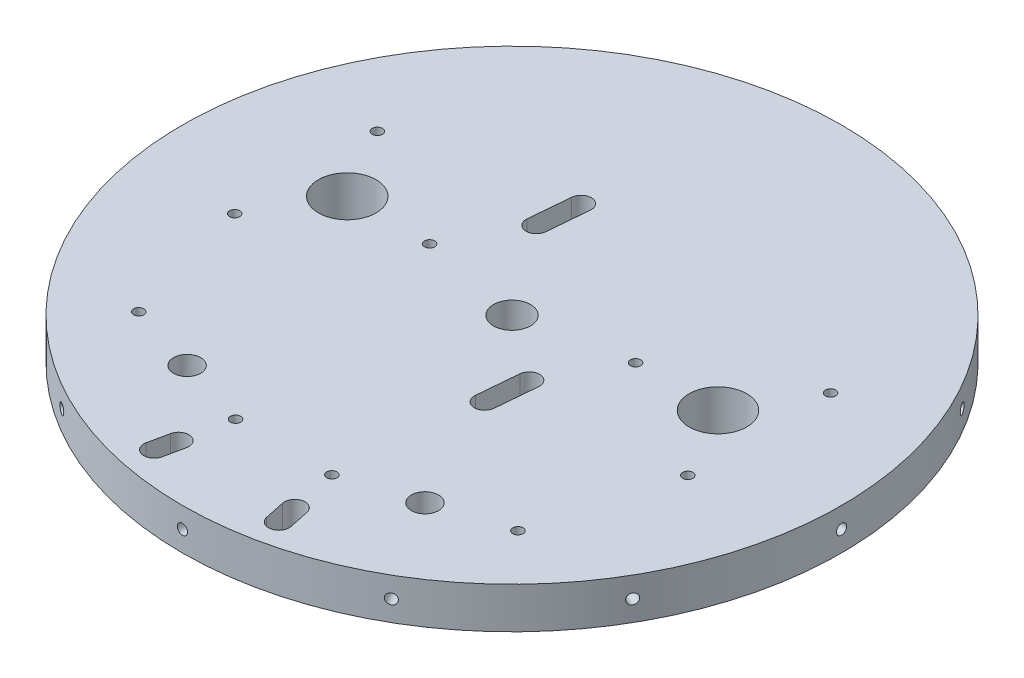
from build123d import *

# Parameters (mm, degrees)
SKETCH1_R           = 80
BOSS_EXTRUDE1_DEPTH = 10
SKETCH3_R           = 4.5
CUT_EXTRUDE1_DEPTH  = 12
SKETCH4_R           = 7
CUT_EXTRUDE2_DEPTH  = 12
SKETCH5_R           = 1.25
CUT_EXTRUDE3_DEPTH  = 15
CIRPATTERN1_COUNT   = 12
CUT_EXTRUDE4_REACH  = 115.578
SKETCH6_R           = 1.25
SKETCH9_R           = 12.5
CUT_EXTRUDE5_DEPTH  = 3
CUT_EXTRUDE6_REACH  = 115.578
SKETCH10_R          = 3.3
CUT_EXTRUDE7_REACH  = 115.578
SKETCH11_R          = 1.25
CUT_EXTRUDE8_REACH  = 115.578
CUT_EXTRUDE10_REACH = 115.578


with BuildPart() as part:
    # Sketch1 → Boss-Extrude1 (new body)
    with BuildSketch(Plane(origin=(0, 0, 0), x_dir=(1, 0, 0), z_dir=(0, 1, 0))):
        Circle(SKETCH1_R)
    extrude(amount=-BOSS_EXTRUDE1_DEPTH)

    # Sketch3 → Cut-Extrude1 (cut)
    with BuildSketch(Plane(origin=(0, 0, 0), x_dir=(1, 0, 0), z_dir=(0, 1, 0))):
        Circle(SKETCH3_R)
    extrude(amount=-CUT_EXTRUDE1_DEPTH, mode=Mode.SUBTRACT)

    # Sketch4 → Cut-Extrude2 (cut)
    with BuildSketch(Plane(origin=(0, 0, 0), x_dir=(1, 0, 0), z_dir=(0, 1, 0))):
        with Locations((-45, 5)):
            Circle(SKETCH4_R)
        with Locations((45, 5)):
            Circle(SKETCH4_R)
    extrude(amount=-CUT_EXTRUDE2_DEPTH, mode=Mode.SUBTRACT)

    # Sketch5 → Cut-Extrude3 (cut)
    with BuildSketch(Plane.XY.offset(80)):
        with Locations((0, -5)):
            Circle(SKETCH5_R)
    cut_extrude3 = extrude(amount=-CUT_EXTRUDE3_DEPTH, mode=Mode.SUBTRACT)

    # CirPattern1: Cut-Extrude3 ×12 about axis
    cirpattern1_axis = Axis((0, 0, 0), (0, 1, 0))
    for i in range(1, CIRPATTERN1_COUNT):
        add(cut_extrude3.rotate(cirpattern1_axis, i * 360 / CIRPATTERN1_COUNT), mode=Mode.SUBTRACT)

    # Sketch6 → Cut-Extrude4 (cut, up to next)
    with BuildSketch(Plane(origin=(0, 0, 0), x_dir=(1, 0, 0), z_dir=(0, 1, 0)), mode=Mode.PRIVATE) as cut_extrude4_sk1:
        with Locations((-25, 5)):
            Circle(SKETCH6_R)
    cut_extrude4_tool1 = extrude(cut_extrude4_sk1.sketch, amount=-CUT_EXTRUDE4_REACH, mode=Mode.PRIVATE) & part.part
    # Sketch6 → Cut-Extrude4 (cut, up to next)
    with BuildSketch(Plane(origin=(0, 0, 0), x_dir=(1, 0, 0), z_dir=(0, 1, 0)), mode=Mode.PRIVATE) as cut_extrude4_sk2:
        with Locations((25, 5)):
            Circle(SKETCH6_R)
    cut_extrude4_tool2 = extrude(cut_extrude4_sk2.sketch, amount=-CUT_EXTRUDE4_REACH, mode=Mode.PRIVATE) & part.part
    # Sketch6 → Cut-Extrude4 (cut, up to next)
    with BuildSketch(Plane(origin=(0, 0, 0), x_dir=(1, 0, 0), z_dir=(0, 1, 0)), mode=Mode.PRIVATE) as cut_extrude4_sk3:
        with Locations((-55, 22.320508076)):
            Circle(SKETCH6_R)
    cut_extrude4_tool3 = extrude(cut_extrude4_sk3.sketch, amount=-CUT_EXTRUDE4_REACH, mode=Mode.PRIVATE) & part.part
    # Sketch6 → Cut-Extrude4 (cut, up to next)
    with BuildSketch(Plane(origin=(0, 0, 0), x_dir=(1, 0, 0), z_dir=(0, 1, 0)), mode=Mode.PRIVATE) as cut_extrude4_sk4:
        with Locations((-55, -12.320508076)):
            Circle(SKETCH6_R)
    cut_extrude4_tool4 = extrude(cut_extrude4_sk4.sketch, amount=-CUT_EXTRUDE4_REACH, mode=Mode.PRIVATE) & part.part
    # Sketch6 → Cut-Extrude4 (cut, up to next)
    with BuildSketch(Plane(origin=(0, 0, 0), x_dir=(1, 0, 0), z_dir=(0, 1, 0)), mode=Mode.PRIVATE) as cut_extrude4_sk5:
        with Locations((55, 22.320508076)):
            Circle(SKETCH6_R)
    cut_extrude4_tool5 = extrude(cut_extrude4_sk5.sketch, amount=-CUT_EXTRUDE4_REACH, mode=Mode.PRIVATE) & part.part
    # Sketch6 → Cut-Extrude4 (cut, up to next)
    with BuildSketch(Plane(origin=(0, 0, 0), x_dir=(1, 0, 0), z_dir=(0, 1, 0)), mode=Mode.PRIVATE) as cut_extrude4_sk6:
        with Locations((55, -12.320508076)):
            Circle(SKETCH6_R)
    cut_extrude4_tool6 = extrude(cut_extrude4_sk6.sketch, amount=-CUT_EXTRUDE4_REACH, mode=Mode.PRIVATE) & part.part
    add(cut_extrude4_tool1.solids().sort_by_distance((-25, 0, -5))[0], mode=Mode.SUBTRACT)
    add(cut_extrude4_tool2.solids().sort_by_distance((25, 0, -5))[0], mode=Mode.SUBTRACT)
    add(cut_extrude4_tool3.solids().sort_by_distance((-55, 0, -22.320508))[0], mode=Mode.SUBTRACT)
    add(cut_extrude4_tool4.solids().sort_by_distance((-55, 0, 12.320508))[0], mode=Mode.SUBTRACT)
    add(cut_extrude4_tool5.solids().sort_by_distance((55, 0, -22.320508))[0], mode=Mode.SUBTRACT)
    add(cut_extrude4_tool6.solids().sort_by_distance((55, 0, 12.320508))[0], mode=Mode.SUBTRACT)

    # Sketch9 → Cut-Extrude5 (cut)
    with BuildSketch(Plane.XZ.offset(10)):
        Circle(SKETCH9_R)
    extrude(amount=-CUT_EXTRUDE5_DEPTH, mode=Mode.SUBTRACT)

    # Sketch10 → Cut-Extrude6 (cut, up to next)
    with BuildSketch(Plane(origin=(0, 0, 0), x_dir=(1, 0, 0), z_dir=(0, 1, 0)), mode=Mode.PRIVATE) as cut_extrude6_sk1:
        with Locations((28.867513459, -50)):
            Circle(SKETCH10_R)
    cut_extrude6_tool1 = extrude(cut_extrude6_sk1.sketch, amount=-CUT_EXTRUDE6_REACH, mode=Mode.PRIVATE) & part.part
    # Sketch10 → Cut-Extrude6 (cut, up to next)
    with BuildSketch(Plane(origin=(0, 0, 0), x_dir=(1, 0, 0), z_dir=(0, 1, 0)), mode=Mode.PRIVATE) as cut_extrude6_sk2:
        with Locations((-28.867513459, -50)):
            Circle(SKETCH10_R)
    cut_extrude6_tool2 = extrude(cut_extrude6_sk2.sketch, amount=-CUT_EXTRUDE6_REACH, mode=Mode.PRIVATE) & part.part
    add(cut_extrude6_tool1.solids().sort_by_distance((28.867513, 0, 50))[0], mode=Mode.SUBTRACT)
    add(cut_extrude6_tool2.solids().sort_by_distance((-28.867513, 0, 50))[0], mode=Mode.SUBTRACT)

    # Sketch11 → Cut-Extrude7 (cut, up to next)
    with BuildSketch(Plane(origin=(0, 0, 0), x_dir=(1, 0, 0), z_dir=(0, 1, 0)), mode=Mode.PRIVATE) as cut_extrude7_sk1:
        with Locations((11.700608346, -55.412704391)):
            Circle(SKETCH11_R)
    cut_extrude7_tool1 = extrude(cut_extrude7_sk1.sketch, amount=-CUT_EXTRUDE7_REACH, mode=Mode.PRIVATE) & part.part
    # Sketch11 → Cut-Extrude7 (cut, up to next)
    with BuildSketch(Plane(origin=(0, 0, 0), x_dir=(1, 0, 0), z_dir=(0, 1, 0)), mode=Mode.PRIVATE) as cut_extrude7_sk2:
        with Locations((-11.700608346, -55.412704391)):
            Circle(SKETCH11_R)
    cut_extrude7_tool2 = extrude(cut_extrude7_sk2.sketch, amount=-CUT_EXTRUDE7_REACH, mode=Mode.PRIVATE) & part.part
    # Sketch11 → Cut-Extrude7 (cut, up to next)
    with BuildSketch(Plane(origin=(0, 0, 0), x_dir=(1, 0, 0), z_dir=(0, 1, 0)), mode=Mode.PRIVATE) as cut_extrude7_sk3:
        with Locations((46.034418573, -44.587295609)):
            Circle(SKETCH11_R)
    cut_extrude7_tool3 = extrude(cut_extrude7_sk3.sketch, amount=-CUT_EXTRUDE7_REACH, mode=Mode.PRIVATE) & part.part
    # Sketch11 → Cut-Extrude7 (cut, up to next)
    with BuildSketch(Plane(origin=(0, 0, 0), x_dir=(1, 0, 0), z_dir=(0, 1, 0)), mode=Mode.PRIVATE) as cut_extrude7_sk4:
        with Locations((-46.034418573, -44.587295609)):
            Circle(SKETCH11_R)
    cut_extrude7_tool4 = extrude(cut_extrude7_sk4.sketch, amount=-CUT_EXTRUDE7_REACH, mode=Mode.PRIVATE) & part.part
    add(cut_extrude7_tool1.solids().sort_by_distance((11.700608, 0, 55.412704))[0], mode=Mode.SUBTRACT)
    add(cut_extrude7_tool2.solids().sort_by_distance((-11.700608, 0, 55.412704))[0], mode=Mode.SUBTRACT)
    add(cut_extrude7_tool3.solids().sort_by_distance((46.034419, 0, 44.587296))[0], mode=Mode.SUBTRACT)
    add(cut_extrude7_tool4.solids().sort_by_distance((-46.034419, 0, 44.587296))[0], mode=Mode.SUBTRACT)

    # Sketch12 → Cut-Extrude8 (cut, up to next)
    with BuildSketch(Plane(origin=(0, 0, 0), x_dir=(1, 0, 0), z_dir=(0, 1, 0)), mode=Mode.PRIVATE) as cut_extrude8_sk1:
        with BuildLine():
            Line((16.560305659, -66.326889066), (17.593297776, -71.219018182))
            ThreePointArc((17.593297776, -71.219018182), (15.663729276, -74.181578798), (12.701168659, -72.252010298))
            Line((12.701168659, -72.252010298), (11.668176543, -67.359881182))
            ThreePointArc((11.668176543, -67.359881182), (13.597745043, -64.397320566), (16.560305659, -66.326889066))
        make_face()
    cut_extrude8_tool1 = extrude(cut_extrude8_sk1.sketch, amount=-CUT_EXTRUDE8_REACH, mode=Mode.PRIVATE) & part.part
    # Sketch12 → Cut-Extrude8 (cut, up to next)
    with BuildSketch(Plane(origin=(0, 0, 0), x_dir=(1, 0, 0), z_dir=(0, 1, 0)), mode=Mode.PRIVATE) as cut_extrude8_sk2:
        with BuildLine():
            Line((-11.668176543, -67.359881182), (-12.701168659, -72.252010298))
            ThreePointArc((-12.701168659, -72.252010298), (-15.663729276, -74.181578798), (-17.593297776, -71.219018182))
            Line((-17.593297776, -71.219018182), (-16.560305659, -66.326889066))
            ThreePointArc((-16.560305659, -66.326889066), (-13.597745043, -64.397320566), (-11.668176543, -67.359881182))
        make_face()
    cut_extrude8_tool2 = extrude(cut_extrude8_sk2.sketch, amount=-CUT_EXTRUDE8_REACH, mode=Mode.PRIVATE) & part.part
    add(cut_extrude8_tool1.solids().sort_by_distance((14.630737, 0, 69.28945))[0], mode=Mode.SUBTRACT)
    add(cut_extrude8_tool2.solids().sort_by_distance((-14.630737, 0, 69.28945))[0], mode=Mode.SUBTRACT)

    # Sketch13 → Cut-Extrude10 (cut, up to next)
    with BuildSketch(Plane(origin=(0, 0, 0), x_dir=(1, 0, 0), z_dir=(0, 1, 0)), mode=Mode.PRIVATE) as cut_extrude10_sk1:
        with BuildLine():
            Line((17.38483505, -21.751421731), (18.256392478, -11.78947475))
            ThreePointArc((18.256392478, -11.78947475), (15.98379509, -9.081098648), (13.275418987, -11.353696036))
            Line((13.275418987, -11.353696036), (12.40386156, -21.315643017))
            ThreePointArc((12.40386156, -21.315643017), (14.676458948, -24.024019119), (17.38483505, -21.751421731))
        make_face()
    cut_extrude10_tool1 = extrude(cut_extrude10_sk1.sketch, amount=-CUT_EXTRUDE10_REACH, mode=Mode.PRIVATE) & part.part
    # Sketch13 → Cut-Extrude10 (cut, up to next)
    with BuildSketch(Plane(origin=(0, 0, 0), x_dir=(1, 0, 0), z_dir=(0, 1, 0)), mode=Mode.PRIVATE) as cut_extrude10_sk2:
        with BuildLine():
            Line((-13.227402612, 24.138411415), (-12.573734541, 31.609871651))
            ThreePointArc((-12.573734541, 31.609871651), (-14.846331929, 34.318247753), (-17.554708031, 32.045650365))
            Line((-17.554708031, 32.045650365), (-18.426265459, 22.083703384))
            ThreePointArc((-18.426265459, 22.083703384), (-16.153668071, 19.375327282), (-13.445291969, 21.64792467))
            Line((-13.445291969, 21.64792467), (-13.227402612, 24.138411415))
        make_face()
    cut_extrude10_tool2 = extrude(cut_extrude10_sk2.sketch, amount=-CUT_EXTRUDE10_REACH, mode=Mode.PRIVATE) & part.part
    add(cut_extrude10_tool1.solids().sort_by_distance((15.330127, 0, 16.552559))[0], mode=Mode.SUBTRACT)
    add(cut_extrude10_tool2.solids().sort_by_distance((-15.5, 0, -26.846788))[0], mode=Mode.SUBTRACT)


solid = part.part
